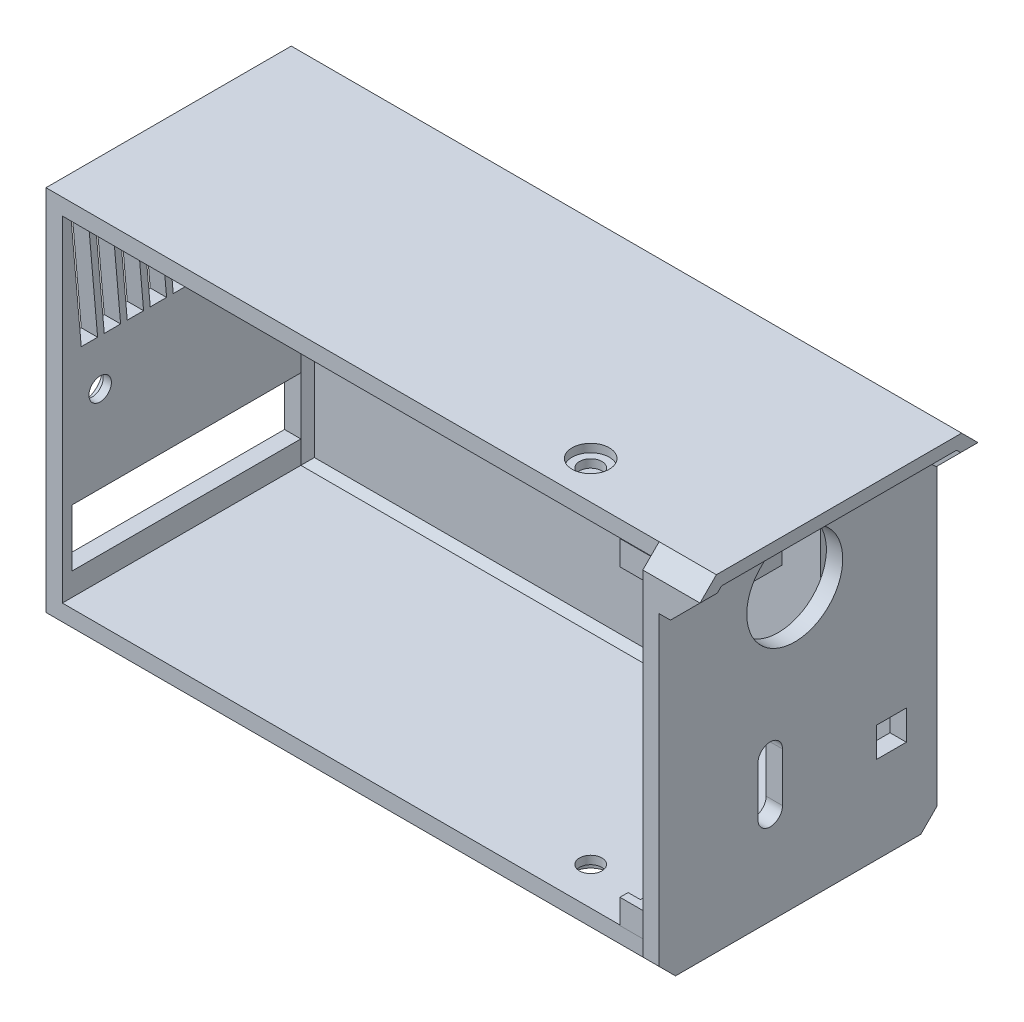
from build123d import *

# Parameters (mm, degrees)
SKETCH1_W              = 77
SKETCH1_H              = 45
BOSS_EXTRUDE1_DEPTH    = 32
CHAMFER1_SIZE          = 2
SHELL1_T               = -2
SKETCH4_W              = 2
SKETCH4_H              = 45
BOSS_EXTRUDE4_DEPTH    = 2
CHAMFER2_SIZE          = 2
BOSS_EXTRUDE5_DEPTH    = 5
CUT_EXTRUDE1_DEPTH     = 60.619627641
SKETCH8_W              = 58
SKETCH8_H              = 23
BOSS_EXTRUDE6_DEPTH    = 5
CUT_EXTRUDE5_START     = -2
CUT_EXTRUDE5_OUTLINE_W = 40.75
CUT_EXTRUDE5_OUTLINE_H = 20.171572875
CUT_EXTRUDE5_DEPTH     = 7
SKETCH9_W              = 55
SKETCH9_H              = 20.171572875
CUT_EXTRUDE7_DEPTH     = 4
CUT_EXTRUDE8_REACH     = 59.433
SKETCH10_R             = 1.25
CUT_EXTRUDE9_DEPTH     = 1
SKETCH12_W             = 1
SKETCH12_H             = 3
BOSS_EXTRUDE7_DEPTH    = 4.73
SKETCH12_4_W           = 2
SKETCH12_4_H           = 3
BOSS_EXTRUDE8_DEPTH    = 3.23
CUT_EXTRUDE3_REACH     = 87.365
SKETCH7_R              = 5.868986284
SKETCH7_W              = 3.63
SKETCH7_H              = 3.63
CUT_EXTRUDE10_REACH    = 91.79
SKETCH13_W             = 28
SKETCH13_H             = 7
CUT_EXTRUDE11_DEPTH    = 1.5
CUT_EXTRUDE12_REACH    = 61.62
SKETCH15_W             = 6
SKETCH15_H             = 7.55
SKETCH16_R             = 2.275
SKETCH16_R_2           = 1.375
CUT_EXTRUDE13_DEPTH    = 1
CUT_EXTRUDE14_REACH    = 93.576
SKETCH16_2_R           = 1.375
SKETCH18_R             = 2.275
SKETCH18_R_2           = 1.375
CUT_EXTRUDE15_DEPTH    = 1
CUT_EXTRUDE16_REACH    = 73.227
SKETCH18_2_R           = 1.375
CUT_EXTRUDE17_START    = -1
SKETCH19_R             = 2.275
SKETCH19_R_2           = 1.375
CUT_EXTRUDE17_DEPTH    = 1
CUT_EXTRUDE18_REACH    = 73.227
SKETCH19_2_R           = 1.375
CUT_EXTRUDE19_REACH    = 93.576


# Read off the part's stored shape, not the designer's step: Cut-Extrude5
with BuildPart() as part:
    # Sketch1 → Boss-Extrude1 (new body)
    with BuildSketch(Plane.XY):
        Rectangle(SKETCH1_W, SKETCH1_H)
    extrude(amount=BOSS_EXTRUDE1_DEPTH)

    # Chamfer1
    chamfer1_edges = [part.edges().sort_by_distance(p)[0] for p in [
        (0, -22.5, 0),
        (-38.5, 0, 0),
        (0, 22.5, 0),
    ]]
    chamfer(chamfer1_edges, length=CHAMFER1_SIZE)

    # Shell1
    shell1_openings = [part.faces().sort_by_distance(p)[0] for p in [
        (0, 0, 32),
    ]]
    offset(amount=SHELL1_T, openings=shell1_openings, kind=Kind.INTERSECTION)

    # Sketch4 → Boss-Extrude4 (add)
    with BuildSketch(Plane(origin=(0, 0, 32), x_dir=(-1, 0, 0), z_dir=(0, 0, -1))):
        with Locations((-37.5, 0)):
            Rectangle(SKETCH4_W, SKETCH4_H)
    extrude(amount=-BOSS_EXTRUDE4_DEPTH)

    # Chamfer2
    chamfer2_edges = [part.edges().sort_by_distance(p)[0] for p in [
        (37.5, -22.5, 34),
        (37.5, 22.5, 34),
    ]]
    chamfer(chamfer2_edges, length=CHAMFER2_SIZE)

    # Sketch3 → Boss-Extrude5 (add)
    with BuildSketch(Plane(origin=(38.5, 0, 0), x_dir=(0, 0, -1), z_dir=(1, 0, 0))):
        Polygon((-34, 16.878679656), (-34, 20.5), (-32, 22.5), (-17, 22.5), (-2, 22.5), (0, 20.5), (0, 16.878679656), (-1.5, 16.878679656), (-1.5, 19.878679656), (-2.621320344, 21), (-17, 21), (-31.378679656, 21), (-32.5, 19.878679656), (-32.5, 16.878679656), align=None)
    extrude(amount=BOSS_EXTRUDE5_DEPTH)

    # Sketch5 → Cut-Extrude1 (cut, through all)
    with BuildSketch(Plane.XY.offset(34)):
        Polygon((43.5, 20.5), (43.5, 16.878679656), (39.878679656, 16.878679656), align=None)
    extrude(amount=-CUT_EXTRUDE1_DEPTH, mode=Mode.SUBTRACT)

    # Sketch8 → Boss-Extrude6 (add)
    with BuildSketch(Plane.XY.offset(2)):
        with Locations((-7.5, 9)):
            Rectangle(SKETCH8_W, SKETCH8_H)
    extrude(amount=BOSS_EXTRUDE6_DEPTH)

    # Cut-Extrude5 outline → Cut-Extrude5 (cut)
    with BuildSketch(Plane.XY.offset(2).offset(CUT_EXTRUDE5_START)):
        with Locations((-7.5, 9.585786438)):
            Rectangle(CUT_EXTRUDE5_OUTLINE_W, CUT_EXTRUDE5_OUTLINE_H)
    extrude(amount=CUT_EXTRUDE5_DEPTH, mode=Mode.SUBTRACT)

    # Sketch9 → Cut-Extrude7 (cut)
    with BuildSketch(Plane(origin=(0, 0, 0), x_dir=(-1, 0, 0), z_dir=(0, 0, -1))):
        with Locations((7.5, 9.585786438)):
            Rectangle(SKETCH9_W, SKETCH9_H)
    extrude(amount=-CUT_EXTRUDE7_DEPTH, mode=Mode.SUBTRACT)

    # Sketch10 → Cut-Extrude8 (cut, up to next)
    with BuildSketch(Plane(origin=(0, 0, 4), x_dir=(-1, 0, 0), z_dir=(0, 0, -1)), mode=Mode.PRIVATE) as cut_extrude8_sk1:
        with Locations((-16.8, 14.585786438)):
            Circle(SKETCH10_R)
    cut_extrude8_tool1 = extrude(cut_extrude8_sk1.sketch, amount=-CUT_EXTRUDE8_REACH, mode=Mode.PRIVATE) & part.part
    # Sketch10 → Cut-Extrude8 (cut, up to next)
    with BuildSketch(Plane(origin=(0, 0, 4), x_dir=(-1, 0, 0), z_dir=(0, 0, -1)), mode=Mode.PRIVATE) as cut_extrude8_sk2:
        with Locations((-16.8, 4.585786438)):
            Circle(SKETCH10_R)
    cut_extrude8_tool2 = extrude(cut_extrude8_sk2.sketch, amount=-CUT_EXTRUDE8_REACH, mode=Mode.PRIVATE) & part.part
    cut_extrude8_1 = cut_extrude8_tool1.solids().sort_by_distance((16.8, 14.585786, 4))[0]
    add(cut_extrude8_1, mode=Mode.SUBTRACT)
    cut_extrude8_2 = cut_extrude8_tool2.solids().sort_by_distance((16.8, 4.585786, 4))[0]
    add(cut_extrude8_2, mode=Mode.SUBTRACT)
    cut_extrude8 = cut_extrude8_1 + cut_extrude8_2  # Cut-Extrude8 as one shape, for the pattern or mirror that repeats it

    # Mirror1: Cut-Extrude8 across plane
    add(cut_extrude8.mirror(Plane.ZY.offset(7.5)), mode=Mode.SUBTRACT)

    # Sketch11 → Cut-Extrude9 (cut, symmetric)
    with BuildSketch(Plane(origin=(0, 0, 5.5), x_dir=(-1, 0, 0), z_dir=(0, 0, -1))):
        Polygon((-13.884381141, 14.585786438), (-15.34219057, 17.110786438), (-18.25780943, 17.110786438), (-19.715618859, 14.585786438), (-18.25780943, 12.060786438), (-15.34219057, 12.060786438), align=None)
        Polygon((-15.34219057, 7.110786438), (-13.884381141, 4.585786438), (-15.34219057, 2.060786438), (-18.25780943, 2.060786438), (-19.715618859, 4.585786438), (-18.25780943, 7.110786438), align=None)
    cut_extrude9 = extrude(amount=CUT_EXTRUDE9_DEPTH, both=True, mode=Mode.SUBTRACT)

    # Mirror2: Cut-Extrude9 across plane
    add(cut_extrude9.mirror(Plane.ZY.offset(7.5)), mode=Mode.SUBTRACT)

    # Sketch12 → Boss-Extrude7 (add)
    with BuildSketch(Plane.ZY.offset(-36.5)):
        with Locations((3.264213562, 19)):
            Rectangle(SKETCH12_W, SKETCH12_H)
        with Locations((31.564213562, 19)):
            Rectangle(SKETCH12_W, SKETCH12_H)
        with Locations((31.564213562, -19)):
            Rectangle(SKETCH12_W, SKETCH12_H)
        with Locations((3.264213562, -19)):
            Rectangle(SKETCH12_W, SKETCH12_H)
    extrude(amount=BOSS_EXTRUDE7_DEPTH)

    # Sketch12<4> → Boss-Extrude8 (add)
    with BuildSketch(Plane.ZY.offset(-36.5)):
        with Locations((4.764213562, 19)):
            Rectangle(SKETCH12_4_W, SKETCH12_4_H)
        with Locations((30.064213562, 19)):
            Rectangle(SKETCH12_4_W, SKETCH12_4_H)
        with Locations((30.064213562, -19)):
            Rectangle(SKETCH12_4_W, SKETCH12_4_H)
        with Locations((4.764213562, -19)):
            Rectangle(SKETCH12_4_W, SKETCH12_4_H)
    extrude(amount=BOSS_EXTRUDE8_DEPTH)

    # Sketch7 → Cut-Extrude3 (cut, up to next)
    with BuildSketch(Plane.ZY.offset(-36.5), mode=Mode.PRIVATE) as cut_extrude3_sk1:
        with Locations((17.414213562, 11.45)):
            Circle(SKETCH7_R)
    cut_extrude3_tool1 = extrude(cut_extrude3_sk1.sketch, amount=-CUT_EXTRUDE3_REACH, mode=Mode.PRIVATE) & part.part
    # Sketch7 → Cut-Extrude3 (cut, up to next)
    with BuildSketch(Plane.ZY.offset(-36.5), mode=Mode.PRIVATE) as cut_extrude3_sk2:
        with BuildLine():
            Line((21.914213562, -5), (21.914213562, -11))
            ThreePointArc((21.914213562, -11), (20.414213562, -12.5), (18.914213562, -11))
            Line((18.914213562, -11), (18.914213562, -5))
            ThreePointArc((18.914213562, -5), (20.414213562, -3.5), (21.914213562, -5))
        make_face()
    cut_extrude3_tool2 = extrude(cut_extrude3_sk2.sketch, amount=-CUT_EXTRUDE3_REACH, mode=Mode.PRIVATE) & part.part
    # Sketch7 → Cut-Extrude3 (cut, up to next)
    with BuildSketch(Plane.ZY.offset(-36.5), mode=Mode.PRIVATE) as cut_extrude3_sk3:
        with Locations((5.579213562, -10.045)):
            Rectangle(SKETCH7_W, SKETCH7_H)
    cut_extrude3_tool3 = extrude(cut_extrude3_sk3.sketch, amount=-CUT_EXTRUDE3_REACH, mode=Mode.PRIVATE) & part.part
    add(cut_extrude3_tool1.solids().sort_by_distance((36.5, 11.45, 17.414214))[0], mode=Mode.SUBTRACT)
    add(cut_extrude3_tool2.solids().sort_by_distance((36.5, -8, 20.414214))[0], mode=Mode.SUBTRACT)
    add(cut_extrude3_tool3.solids().sort_by_distance((36.5, -10.045, 5.579214))[0], mode=Mode.SUBTRACT)

    # Sketch13 → Cut-Extrude10 (cut, up to next)
    with BuildSketch(Plane(origin=(-36.5, 0, 0), x_dir=(0, 0, -1), z_dir=(1, 0, 0)), mode=Mode.PRIVATE) as cut_extrude10_sk1:
        with Locations((-16.828427125, -14.2)):
            Rectangle(SKETCH13_W, SKETCH13_H)
    cut_extrude10_tool1 = extrude(cut_extrude10_sk1.sketch, amount=-CUT_EXTRUDE10_REACH, mode=Mode.PRIVATE) & part.part
    add(cut_extrude10_tool1.solids().sort_by_distance((-36.5, -14.2, 16.828427))[0], mode=Mode.SUBTRACT)

    # Sketch14 → Cut-Extrude11 (cut)
    with BuildSketch(Plane(origin=(0, 0, 0), x_dir=(-1, 0, 0), z_dir=(0, 0, -1))):
        Polygon((-29.25, 10.884824543), (-28.125, 8.936267385), (-30.375, 8.936267385), align=None)
    extrude(amount=-CUT_EXTRUDE11_DEPTH, mode=Mode.SUBTRACT)

    # Sketch15 → Cut-Extrude12 (cut, up to next)
    with BuildSketch(Plane(origin=(0, 0, 0), x_dir=(-1, 0, 0), z_dir=(0, 0, -1)), mode=Mode.PRIVATE) as cut_extrude12_sk1:
        with Locations((-29.25, 2.37259225)):
            Rectangle(SKETCH15_W, SKETCH15_H)
    cut_extrude12_tool1 = extrude(cut_extrude12_sk1.sketch, amount=-CUT_EXTRUDE12_REACH, mode=Mode.PRIVATE) & part.part
    add(cut_extrude12_tool1.solids().sort_by_distance((29.25, 2.372592, 0))[0], mode=Mode.SUBTRACT)

    # Sketch16 → Cut-Extrude13 (cut)
    with BuildSketch(Plane(origin=(-38.5, 0, 0), x_dir=(0, 0, -1), z_dir=(1, 0, 0))):
        with Locations(Location((-27.375, -0.125, 0), (0, 0, 90))):
            Circle(SKETCH16_R)
        with Locations(Location((-27.375, -0.125, 0), (0, 0, 90))):
            Circle(SKETCH16_R_2, mode=Mode.SUBTRACT)
    extrude(amount=CUT_EXTRUDE13_DEPTH, mode=Mode.SUBTRACT)

    # Sketch16<2> → Cut-Extrude14 (cut, up to next)
    with BuildSketch(Plane(origin=(-38.5, 0, 0), x_dir=(0, 0, -1), z_dir=(1, 0, 0)), mode=Mode.PRIVATE) as cut_extrude14_sk1:
        with Locations(Location((-27.375, -0.125, 0), (0, 0, 90))):
            Circle(SKETCH16_2_R)
    cut_extrude14_tool1 = extrude(cut_extrude14_sk1.sketch, amount=CUT_EXTRUDE14_REACH, mode=Mode.PRIVATE) & part.part
    add(cut_extrude14_tool1.solids().sort_by_distance((-38.5, -0.125, 27.375))[0], mode=Mode.SUBTRACT)

    # Sketch18 → Cut-Extrude15 (cut)
    with BuildSketch(Plane.XZ.offset(22.5)):
        with Locations(Location((23.5, 27.375, 0), (0, 0, 270))):
            Circle(SKETCH18_R)
        with Locations(Location((23.5, 27.375, 0), (0, 0, 270))):
            Circle(SKETCH18_R_2, mode=Mode.SUBTRACT)
    extrude(amount=-CUT_EXTRUDE15_DEPTH, mode=Mode.SUBTRACT)

    # Sketch18<2> → Cut-Extrude16 (cut, up to next)
    with BuildSketch(Plane.XZ.offset(22.5), mode=Mode.PRIVATE) as cut_extrude16_sk1:
        with Locations(Location((23.5, 27.375, 0), (0, 0, 90))):
            Circle(SKETCH18_2_R)
    cut_extrude16_tool1 = extrude(cut_extrude16_sk1.sketch, amount=-CUT_EXTRUDE16_REACH, mode=Mode.PRIVATE) & part.part
    add(cut_extrude16_tool1.solids().sort_by_distance((23.5, -22.5, 27.375))[0], mode=Mode.SUBTRACT)

    # Sketch19 → Cut-Extrude17 (cut)
    with BuildSketch(Plane(origin=(0, 22.5, 0), x_dir=(1, 0, 0), z_dir=(0, 1, 0)).offset(CUT_EXTRUDE17_START)):
        with Locations(Location((23.5, -27.375, 0), (0, 0, 90))):
            Circle(SKETCH19_R)
        with Locations(Location((23.5, -27.375, 0), (0, 0, 270))):
            Circle(SKETCH19_R_2, mode=Mode.SUBTRACT)
    extrude(amount=CUT_EXTRUDE17_DEPTH, mode=Mode.SUBTRACT)

    # Sketch19<2> → Cut-Extrude18 (cut, up to next)
    with BuildSketch(Plane(origin=(0, 22.5, 0), x_dir=(1, 0, 0), z_dir=(0, 1, 0)), mode=Mode.PRIVATE) as cut_extrude18_sk1:
        with Locations(Location((23.5, -27.375, 0), (0, 0, 270))):
            Circle(SKETCH19_2_R)
    cut_extrude18_tool1 = extrude(cut_extrude18_sk1.sketch, amount=-CUT_EXTRUDE18_REACH, mode=Mode.PRIVATE) & part.part
    add(cut_extrude18_tool1.solids().sort_by_distance((23.5, 22.5, 27.375))[0], mode=Mode.SUBTRACT)

    # Sketch20 → Cut-Extrude19 (cut, up to next)
    with BuildSketch(Plane.ZY.offset(38.5), mode=Mode.PRIVATE) as cut_extrude19_sk1:
        Polygon((9.312329953, 20.5), (11.312329953, 20.5), (10, 5.5), (8, 5.5), align=None)
    cut_extrude19_tool1 = extrude(cut_extrude19_sk1.sketch, amount=-CUT_EXTRUDE19_REACH, mode=Mode.PRIVATE) & part.part
    # Sketch20 → Cut-Extrude19 (cut, up to next)
    with BuildSketch(Plane.ZY.offset(38.5), mode=Mode.PRIVATE) as cut_extrude19_sk2:
        Polygon((12.812524292, 5.5), (10.812524292, 5.5), (12.124854245, 20.5), (14.124854245, 20.5), align=None)
    cut_extrude19_tool2 = extrude(cut_extrude19_sk2.sketch, amount=-CUT_EXTRUDE19_REACH, mode=Mode.PRIVATE) & part.part
    # Sketch20 → Cut-Extrude19 (cut, up to next)
    with BuildSketch(Plane.ZY.offset(38.5), mode=Mode.PRIVATE) as cut_extrude19_sk3:
        Polygon((15.625048585, 5.5), (13.625048585, 5.5), (14.937378538, 20.5), (16.937378538, 20.5), align=None)
    cut_extrude19_tool3 = extrude(cut_extrude19_sk3.sketch, amount=-CUT_EXTRUDE19_REACH, mode=Mode.PRIVATE) & part.part
    # Sketch20 → Cut-Extrude19 (cut, up to next)
    with BuildSketch(Plane.ZY.offset(38.5), mode=Mode.PRIVATE) as cut_extrude19_sk4:
        Polygon((18.437572877, 5.5), (16.437572877, 5.5), (17.74990283, 20.5), (19.74990283, 20.5), align=None)
    cut_extrude19_tool4 = extrude(cut_extrude19_sk4.sketch, amount=-CUT_EXTRUDE19_REACH, mode=Mode.PRIVATE) & part.part
    # Sketch20 → Cut-Extrude19 (cut, up to next)
    with BuildSketch(Plane.ZY.offset(38.5), mode=Mode.PRIVATE) as cut_extrude19_sk5:
        Polygon((21.25009717, 5.5), (19.25009717, 5.5), (20.562427123, 20.5), (22.562427123, 20.5), align=None)
    cut_extrude19_tool5 = extrude(cut_extrude19_sk5.sketch, amount=-CUT_EXTRUDE19_REACH, mode=Mode.PRIVATE) & part.part
    # Sketch20 → Cut-Extrude19 (cut, up to next)
    with BuildSketch(Plane.ZY.offset(38.5), mode=Mode.PRIVATE) as cut_extrude19_sk6:
        Polygon((24.062621462, 5.5), (22.062621462, 5.5), (23.374951415, 20.5), (25.374951415, 20.5), align=None)
    cut_extrude19_tool6 = extrude(cut_extrude19_sk6.sketch, amount=-CUT_EXTRUDE19_REACH, mode=Mode.PRIVATE) & part.part
    # Sketch20 → Cut-Extrude19 (cut, up to next)
    with BuildSketch(Plane.ZY.offset(38.5), mode=Mode.PRIVATE) as cut_extrude19_sk7:
        Polygon((26.875145755, 5.5), (24.875145755, 5.5), (26.187475708, 20.5), (28.187475708, 20.5), align=None)
    cut_extrude19_tool7 = extrude(cut_extrude19_sk7.sketch, amount=-CUT_EXTRUDE19_REACH, mode=Mode.PRIVATE) & part.part
    # Sketch20 → Cut-Extrude19 (cut, up to next)
    with BuildSketch(Plane.ZY.offset(38.5), mode=Mode.PRIVATE) as cut_extrude19_sk8:
        Polygon((29.687670047, 5.5), (27.687670047, 5.5), (29, 20.5), (31, 20.5), align=None)
    cut_extrude19_tool8 = extrude(cut_extrude19_sk8.sketch, amount=-CUT_EXTRUDE19_REACH, mode=Mode.PRIVATE) & part.part
    add(cut_extrude19_tool1.solids().sort_by_distance((-38.5, 13, 9.656165))[0], mode=Mode.SUBTRACT)
    add(cut_extrude19_tool2.solids().sort_by_distance((-38.5, 13, 12.468689))[0], mode=Mode.SUBTRACT)
    add(cut_extrude19_tool3.solids().sort_by_distance((-38.5, 13, 15.281214))[0], mode=Mode.SUBTRACT)
    add(cut_extrude19_tool4.solids().sort_by_distance((-38.5, 13, 18.093738))[0], mode=Mode.SUBTRACT)
    add(cut_extrude19_tool5.solids().sort_by_distance((-38.5, 13, 20.906262))[0], mode=Mode.SUBTRACT)
    add(cut_extrude19_tool6.solids().sort_by_distance((-38.5, 13, 23.718786))[0], mode=Mode.SUBTRACT)
    add(cut_extrude19_tool7.solids().sort_by_distance((-38.5, 13, 26.531311))[0], mode=Mode.SUBTRACT)
    add(cut_extrude19_tool8.solids().sort_by_distance((-38.5, 13, 29.343835))[0], mode=Mode.SUBTRACT)


solid = part.part
